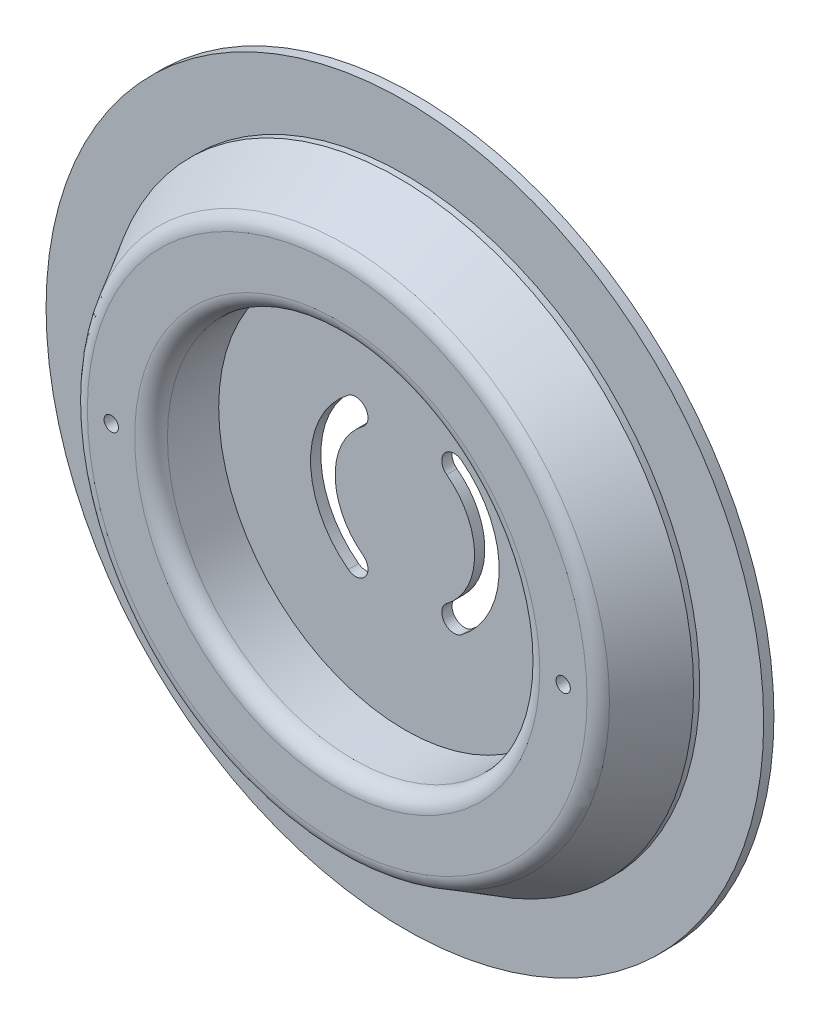
from build123d import *

# Parameters (mm, degrees)
SKETCH1_R           = 87.5
BOSS_EXTRUDE1_DEPTH = 9.5
SKETCH2_R           = 87.5
SKETCH2_R_2         = 71.9
CUT_EXTRUDE1_DEPTH  = 16.5
SKETCH3_R           = 45.4
CUT_EXTRUDE2_DEPTH  = 16.5
CHAMFER1_SIZE       = 15
CHAMFER1_SIZE2      = 8.660254038
FILLET1_R           = 4
CUT_EXTRUDE3_DEPTH  = 126.193849689
SKETCH6_R           = 1.75
CUT_EXTRUDE4_DEPTH  = 126.193849689


# Read off the part's stored shape, not the designer's step: Shell1
with BuildPart() as part:
    # Sketch1 → Boss-Extrude1 (new, symmetric)
    with BuildSketch(Plane.XY):
        Circle(SKETCH1_R)
    extrude(amount=BOSS_EXTRUDE1_DEPTH, both=True)

    # Sketch2 → Cut-Extrude1 (cut)
    with BuildSketch(Plane.XY.offset(9.5)):
        Circle(SKETCH2_R)
        Circle(SKETCH2_R_2, mode=Mode.SUBTRACT)
    extrude(amount=-CUT_EXTRUDE1_DEPTH, mode=Mode.SUBTRACT)

    # Sketch3 → Cut-Extrude2 (cut)
    with BuildSketch(Plane.XY.offset(9.5)):
        Circle(SKETCH3_R)
    extrude(amount=-CUT_EXTRUDE2_DEPTH, mode=Mode.SUBTRACT)

    # Chamfer1
    chamfer1_edges = [part.edges().sort_by_distance(p)[0] for p in [
        (-71.9, 0, 9.5),
    ]]
    chamfer1_side = [part.faces().sort_by_distance(p)[0] for p in [
        (-71.9, 0, 1.25),
    ]]
    chamfer(chamfer1_edges, length=CHAMFER1_SIZE, length2=CHAMFER1_SIZE2, reference=chamfer1_side[0])

    # Fillet1
    fillet1_edges = [part.edges().sort_by_distance(p)[0] for p in [
        (-45.4, 0, 9.5),
        (-63.239745962, 0, 9.5),
    ]]
    fillet(fillet1_edges, radius=FILLET1_R)

    # Shell1 outline → Shell1 (revolve, cut)
    with BuildSketch(Plane.XZ):
        with BuildLine():
            Line((47.9, -9.5), (69.4, -9.5))
            Line((69.4, -9.5), (69.4, -6.169872981))
            Line((69.4, -6.169872981), (62.229382991, 6.25))
            ThreePointArc((62.229382991, 6.25), (61.680344885, 6.799038106), (60.930344885, 7))
            Line((60.930344885, 7), (49.4, 7))
            ThreePointArc((49.4, 7), (48.339339828, 6.560660172), (47.9, 5.5))
            Line((47.9, 5.5), (47.9, -9.5))
        make_face()
    revolve(axis=Axis((0, 0, 0), (0, 0, 1)), mode=Mode.SUBTRACT)

    # Sketch5 → Cut-Extrude3 (cut, through all)
    with BuildSketch(Plane(origin=(0, 0, -9.5), x_dir=(-1, 0, 0), z_dir=(0, 0, -1))):
        with BuildLine():
            ThreePointArc((-13.8, 18.4), (-23, 0), (-13.8, -18.4))
            ThreePointArc((-13.8, -18.4), (-9.6, -17.8), (-10.2, -13.6))
            ThreePointArc((-10.2, -13.6), (-17, 0), (-10.2, 13.6))
            ThreePointArc((-10.2, 13.6), (-9.6, 17.8), (-13.8, 18.4))
        make_face()
    cut_extrude3 = extrude(amount=-CUT_EXTRUDE3_DEPTH, mode=Mode.SUBTRACT)

    # Mirror1: Cut-Extrude3 across plane
    add(cut_extrude3.mirror(Plane(origin=(0, 0, 0), x_dir=(0, 0, 1), z_dir=(1, 0, 0))), mode=Mode.SUBTRACT)

    # Sketch6 → Cut-Extrude4 (cut, through all)
    with BuildSketch(Plane.XY.offset(9.5)):
        with Locations((-55.1, 0)):
            Circle(SKETCH6_R)
    cut_extrude4 = extrude(amount=-CUT_EXTRUDE4_DEPTH, mode=Mode.SUBTRACT)

    # Mirror2: Cut-Extrude4 across plane
    add(cut_extrude4.mirror(Plane(origin=(0, 0, 0), x_dir=(0, 0, 1), z_dir=(1, 0, 0))), mode=Mode.SUBTRACT)


solid = part.part
